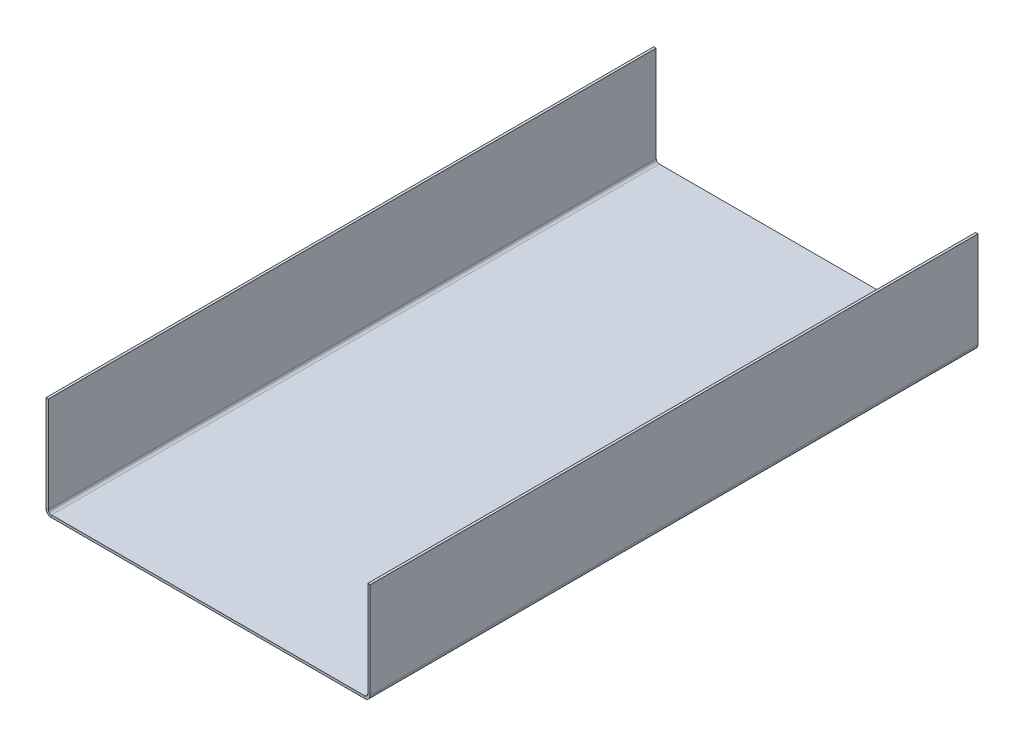
from build123d import *

# Parameters (mm, degrees)
BASE_FLANGE1_DEPTH = 381


# Sheet-metal steps are written as plain solids
with BuildPart() as part:
    # Sketch2 → Base-Flange1 (new body)
    with BuildSketch(Plane.XY):
        with BuildLine():
            Line((0, 63.5), (0, 3.42392))
            ThreePointArc((0, 3.42392), (1.00284295, 1.00284295), (3.42392, 0))
            Line((3.42392, 0), (199.77608, 0))
            ThreePointArc((199.77608, 0), (202.19715705, 1.00284295), (203.2, 3.42392))
            Line((203.2, 3.42392), (203.2, 63.5))
            Line((203.2, 63.5), (201.68108, 63.5))
            Line((201.68108, 63.5), (201.68108, 3.42392))
            ThreePointArc((201.68108, 3.42392), (201.123118418, 2.076881582), (199.77608, 1.51892))
            Line((199.77608, 1.51892), (3.42392, 1.51892))
            ThreePointArc((3.42392, 1.51892), (2.076881582, 2.076881582), (1.51892, 3.42392))
            Line((1.51892, 3.42392), (1.51892, 63.5))
            Line((1.51892, 63.5), (0, 63.5))
        make_face()
    extrude(amount=BASE_FLANGE1_DEPTH)


solid = part.part
